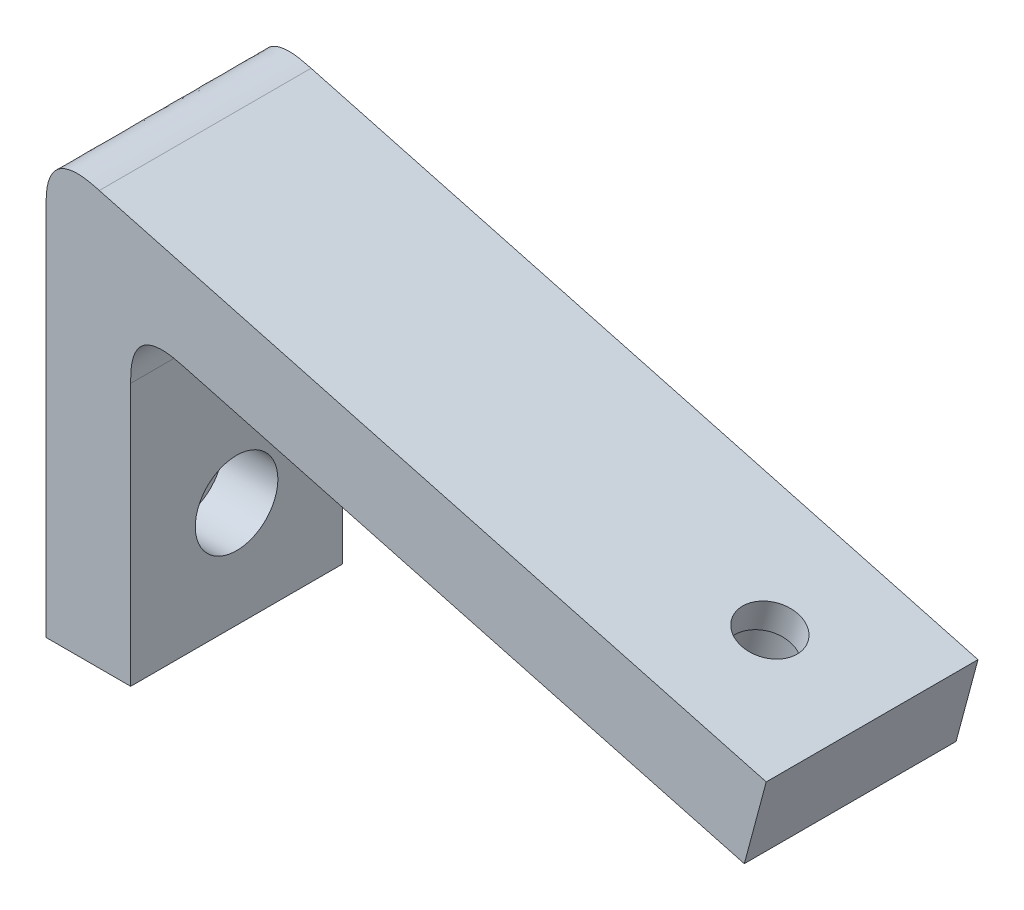
from build123d import *

# Parameters (mm, degrees)
BOSS_EXTRUDE1_DEPTH         = 25.4
F_1_4_CLEARANCE_HOLE1_D     = 6.7564
F_1_4_CLEARANCE_HOLE1_DEPTH = 10.16
F_1_4_CLEARANCE_HOLE1_TIP   = 2.029827343
F_1_4_CLEARANCE_HOLE2_D     = 6.7564
F_1_4_CLEARANCE_HOLE2_DEPTH = 10.16
F_1_4_CLEARANCE_HOLE2_TIP   = 2.029827343
SKETCH8_R                   = 4.953
CUT_EXTRUDE1_DEPTH          = 6.604
SKETCH9_R                   = 4.953
CUT_EXTRUDE2_DEPTH          = 6.604


with BuildPart() as part:
    # Sketch1 → Boss-Extrude1 (new body)
    with BuildSketch(Plane.XY):
        Polygon((10.16, 0), (0, 0), (0, 51.340769788), (86.393149461, 28.191795158), (83.763547963, 18.377988763), (10.16, 38.1), align=None)
    extrude(amount=BOSS_EXTRUDE1_DEPTH)

    # 1/4 Clearance Hole1
    with Locations(Plane.ZY):
        with Locations((12.7, 12.7)):
            Hole(F_1_4_CLEARANCE_HOLE1_D / 2, depth=F_1_4_CLEARANCE_HOLE1_DEPTH)
            with Locations((0, 0, -(F_1_4_CLEARANCE_HOLE1_DEPTH + F_1_4_CLEARANCE_HOLE1_TIP / 2))):  # 118° drill point
                Cone(0, F_1_4_CLEARANCE_HOLE1_D / 2, F_1_4_CLEARANCE_HOLE1_TIP, mode=Mode.SUBTRACT)

    # 1/4 Clearance Hole2
    with Locations(Plane(origin=(12.835192447, 47.901590337, 0), x_dir=(0.9659258262890674, -0.2588190451025242, 0), z_dir=(0.2588190451025242, 0.9659258262890674, 0))):
        with Locations((63.452800777, -12.7)):
            Hole(F_1_4_CLEARANCE_HOLE2_D / 2, depth=F_1_4_CLEARANCE_HOLE2_DEPTH)
            with Locations((0, 0, -(F_1_4_CLEARANCE_HOLE2_DEPTH + F_1_4_CLEARANCE_HOLE2_TIP / 2))):  # 118° drill point
                Cone(0, F_1_4_CLEARANCE_HOLE2_D / 2, F_1_4_CLEARANCE_HOLE2_TIP, mode=Mode.SUBTRACT)

    # Fillet1
    # a fillet whose section is not a circle: 5.08 mm, written as the material it adds along each edge (its section moved 0.00015 mm through the faces so that the kernel can cut it)
    with BuildSketch(Plane(origin=(10.16, 38.1, 0), x_dir=(0.9659316901800618, -0.25879715977168133, 0), z_dir=(0, 0, 1))) as fillet1_piece_1:
        with BuildLine():
            add(Edge.make_bspline([(6.620384896, 0), (5.560159502, 2.4022e-05), (4.499934108, 4.8044e-05), (2.201778974, -0.538520049), (1.089942696, -1.987425322), (1.164425276, -4.346667776), (1.438808597, -5.370773083), (1.713191917, -6.39487839)], knots=[0, 0, 0, 0, 0, 0, 0.5, 0.5, 1, 1, 1, 1, 1, 1], degree=5))
            Line((1.713191917, -6.39487839), (1.615053258, -6.421172181))
            ThreePointArc((1.615053258, -6.421172181), (0.758529744, -3.223713577), (-0.09813866, -0.026293791))
            Line((-0.09813866, -0.026293791), (2.302e-06, 0.1016))
            ThreePointArc((2.302e-06, 0.1016), (3.310194748, 0.101525), (6.620387198, 0.1016))
            Line((6.620387198, 0.1016), (6.620384896, 0))
        make_face()
    extrude(amount=25.4)
    # a fillet whose section is not a circle: 5.08 mm, written as the material it takes off along each edge (its section moved 0.00015 mm through the faces so that the kernel can cut it)
    with BuildSketch(Plane(origin=(0, 51.340769788, -16.550962239), x_dir=(-2.2657292946318672e-05, -0.9999999997433235, 0), z_dir=(0, 0, 1))) as fillet1_2_piece_1:
        with BuildLine():
            add(Edge.make_bspline([(6.620384896, 0), (5.560159502, -2.4022e-05), (4.499934108, -4.8044e-05), (2.201778974, 0.538520049), (1.089942696, 1.987425322), (1.164425276, 4.346667776), (1.438808597, 5.370773083), (1.713191917, 6.39487839)], knots=[0, 0, 0, 0, 0, 0, 0.5, 0.5, 1, 1, 1, 1, 1, 1], degree=5))
            Line((1.713191917, 6.39487839), (1.615053258, 6.421172181))
            ThreePointArc((1.615053258, 6.421172181), (0.758529744, 3.223713577), (-0.09813866, 0.026293791))
            Line((-0.09813866, 0.026293791), (2.302e-06, -0.1016))
            ThreePointArc((2.302e-06, -0.1016), (3.310194748, -0.101525), (6.620387198, -0.1016))
            Line((6.620387198, -0.1016), (6.620384896, 0))
        make_face()
    extrude(amount=58.501924479, mode=Mode.SUBTRACT)

    # Sketch8 → Cut-Extrude1 (cut)
    with BuildSketch(Plane(origin=(10.205590949, 38.087783942, 0), x_dir=(0.9659258262890673, -0.2588190451025246, 0), z_dir=(-0.2588190451025246, -0.9659258262890674, 0))):
        with Locations((63.452800777, 12.7)):
            Circle(SKETCH8_R)
    extrude(amount=-CUT_EXTRUDE1_DEPTH, mode=Mode.SUBTRACT)

    # Sketch9 → Cut-Extrude2 (cut)
    with BuildSketch(Plane(origin=(10.16, 0, 0), x_dir=(0, 0, -1), z_dir=(1, 0, 0))):
        with Locations(Location((-12.7, 12.7, 0), (0, 0, 90))):
            Circle(SKETCH9_R)
    extrude(amount=-CUT_EXTRUDE2_DEPTH, mode=Mode.SUBTRACT)


solid = part.part
